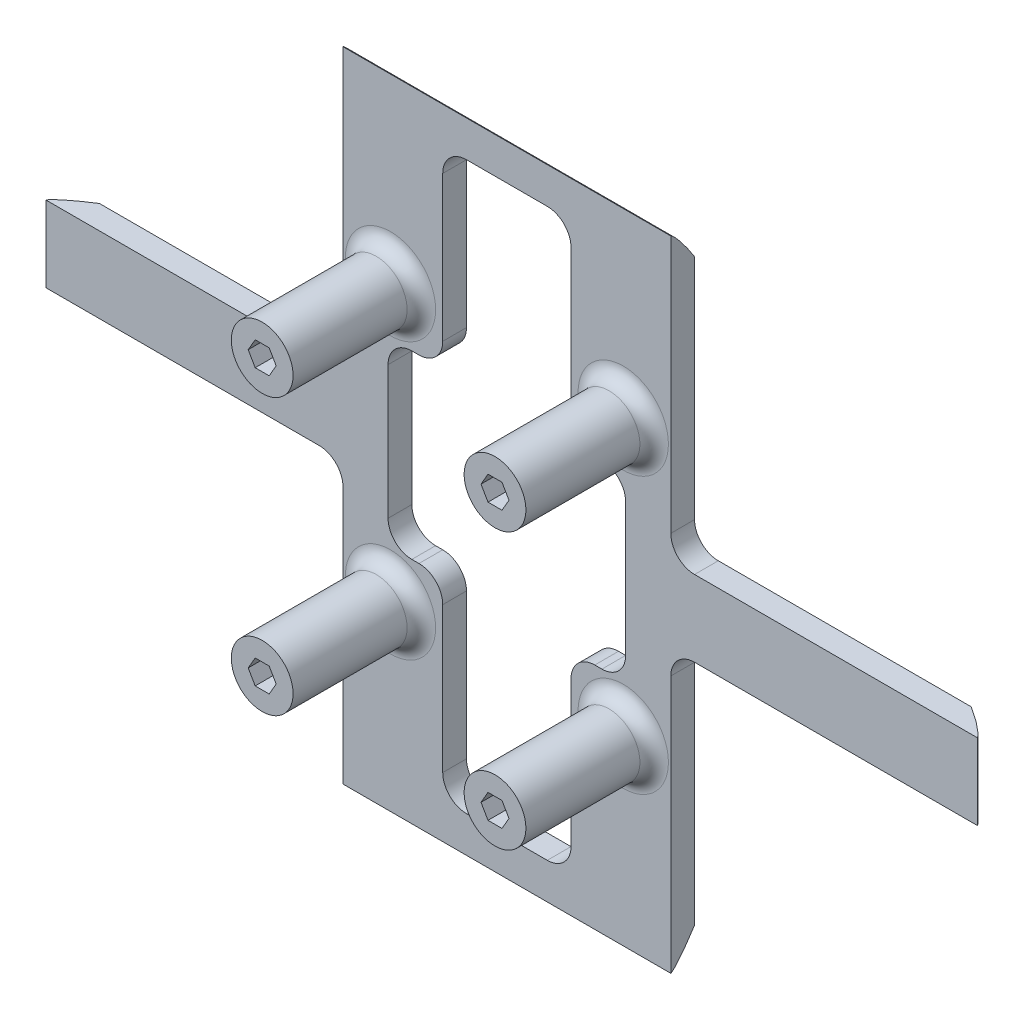
from build123d import *

# Parameters (mm, degrees)
BOSS_EXTRUDE1_DEPTH = 6.5
FILLET4_START       = -8
FILLET4_DEPTH       = 16
FILLET4_START_2     = -34.5
FILLET4_2_DEPTH     = 69
SKETCH4_W           = 251.095983112
SKETCH4_H           = 149.113377468
CUT_EXTRUDE2_DEPTH  = 1.5
SKETCH6_R           = 6.5
BOSS_EXTRUDE3_DEPTH = 27
FILLET3_R           = 3
CUT_EXTRUDE3_DEPTH  = 18
MIRROR1_START       = 6.5
MIRROR1_OUTLINE_R   = 6.5
MIRROR1_DEPTH       = 27
MIRROR1_2_DEPTH     = 9
CUT_EXTRUDE6_REACH  = 125.858


with BuildPart() as part:
    # Sketch1 → Boss-Extrude1 (new body)
    with BuildSketch(Plane.XY):
        with BuildLine():
            Line((34.5, -13), (34.5, -67.2))
            Line((34.5, -67.2), (-34.5, -67.2))
            Line((-34.5, -67.2), (-34.5, -13))
            ThreePointArc((-34.5, -13), (-35.964466094, -9.464466094), (-39.5, -8))
            Line((-39.5, -8), (-97, -8))
            Line((-97, -8), (-97, 8))
            Line((-97, 8), (-39.5, 8))
            ThreePointArc((-39.5, 8), (-35.964466094, 9.464466094), (-34.5, 13))
            Line((-34.5, 13), (-34.5, 67.2))
            Line((-34.5, 67.2), (34.5, 67.2))
            Line((34.5, 67.2), (34.5, 13))
            ThreePointArc((34.5, 13), (35.964466094, 9.464466094), (39.5, 8))
            Line((39.5, 8), (83.5, 8))
            Line((83.5, 8), (99, 8))
            Line((99, 8), (99, -8))
            Line((99, -8), (39.5, -8))
            ThreePointArc((39.5, -8), (35.964466094, -9.464466094), (34.5, -13))
        make_face()
    extrude(amount=BOSS_EXTRUDE1_DEPTH)

    # Fillet4: read off the stored shape, not the designer's step
    # Fillet4 outline → Fillet4 (cut)
    with BuildSketch(Plane(origin=(0, 0, 0), x_dir=(1, 0, 0), z_dir=(0, 1, 0)).offset(FILLET4_START)):
        with BuildLine():
            add(Edge.make_bspline(
                [(-97, -6.5), (-94.571389667, 0), (-87.632503002, 0)],
                knots=[0, 0, 0, 1, 1, 1], degree=2, weights=[1, 0.176470588, 1]))
            Line((-87.632503002, 0), (-97, 0))
            Line((-97, 0), (-97, -6.5))
        make_face()
        with BuildLine():
            add(Edge.make_bspline(
                [(99, -6.5), (96.571389667, 0), (89.632503002, 0)],
                knots=[0, 0, 0, 1, 1, 1], degree=2, weights=[1, 0.176470588, 1]))
            Line((99, -6.5), (99, 0))
            Line((99, 0), (89.632503002, 0))
        make_face()
    extrude(amount=FILLET4_DEPTH, mode=Mode.SUBTRACT)

    # Fillet4 2 outline → Fillet4 2 (cut)
    with BuildSketch(Plane.YZ.offset(FILLET4_START_2)):
        with BuildLine():
            Line((67.2, 0), (67.2, 6.5))
            add(Edge.make_bspline(
                [(67.2, 6.5), (64.771389667, 0), (57.832503002, 0)],
                knots=[0, 0, 0, 1, 1, 1], degree=2, weights=[1, 0.176470588, 1]))
            Line((57.832503002, 0), (67.2, 0))
        make_face()
        with BuildLine():
            Line((-67.2, 0), (-57.832503002, 0))
            add(Edge.make_bspline(
                [(-67.2, 6.5), (-64.771389667, 0), (-57.832503002, 0)],
                knots=[0, 0, 0, 1, 1, 1], degree=2, weights=[1, 0.176470588, 1]))
            Line((-67.2, 6.5), (-67.2, 0))
        make_face()
    extrude(amount=FILLET4_2_DEPTH, mode=Mode.SUBTRACT)

    # Sketch4 → Cut-Extrude2 (cut)
    with BuildSketch(Plane.XY):
        Rectangle(SKETCH4_W, SKETCH4_H)
    extrude(amount=CUT_EXTRUDE2_DEPTH, mode=Mode.SUBTRACT)

    # Sketch6 → Boss-Extrude3 (add)
    with BuildSketch(Plane.XY.offset(6.5)):
        with Locations((-24.5, 29)):
            Circle(SKETCH6_R)
    extrude(amount=BOSS_EXTRUDE3_DEPTH)

    # Fillet3
    fillet3_edges = [part.edges().sort_by_distance(p)[0] for p in [
        (-31, 29, 6.5),
    ]]
    fillet(fillet3_edges, radius=FILLET3_R)

    # Sketch7 → Cut-Extrude3 (cut)
    with BuildSketch(Plane.XY.offset(33.5)):
        Polygon((-27.444486373, 29), (-25.972243186, 26.45), (-23.027756814, 26.45), (-21.555513627, 29), (-23.027756814, 31.55), (-25.972243186, 31.55), align=None)
    extrude(amount=-CUT_EXTRUDE3_DEPTH, mode=Mode.SUBTRACT)

    # Mirror1: read off the stored shape, not the designer's step
    # Mirror1 outline → Mirror1 (add)
    # profile 1 of 3: a face of its own
    with BuildSketch(Plane.XY.offset(MIRROR1_START)):
        with Locations((24.5, 29)):
            Circle(MIRROR1_OUTLINE_R)
        Polygon((21.555513627, 29), (23.027756814, 31.55), (25.972243186, 31.55), (27.444486373, 29), (25.972243186, 26.45), (23.027756814, 26.45), align=None, mode=Mode.SUBTRACT)
    # profile 2 of 3: a face of its own
    with BuildSketch(Plane.XY.offset(MIRROR1_START)):
        with Locations((-24.5, -29)):
            Circle(MIRROR1_OUTLINE_R)
        Polygon((-23.027756814, -31.55), (-25.972243186, -31.55), (-27.444486373, -29), (-25.972243186, -26.45), (-23.027756814, -26.45), (-21.555513627, -29), align=None, mode=Mode.SUBTRACT)
    # profile 3 of 3: a face of its own
    with BuildSketch(Plane.XY.offset(MIRROR1_START)):
        with Locations((24.5, -29)):
            Circle(MIRROR1_OUTLINE_R)
        Polygon((23.027756814, -26.45), (25.972243186, -26.45), (27.444486373, -29), (25.972243186, -31.55), (23.027756814, -31.55), (21.555513627, -29), align=None, mode=Mode.SUBTRACT)
    extrude(amount=MIRROR1_DEPTH)

    # Mirror1 2 outline → Mirror1 2 (add)
    with BuildSketch(Plane.XY.offset(MIRROR1_START)):
        Polygon((25.972243186, 31.55), (23.027756814, 31.55), (21.555513627, 29), (23.027756814, 26.45), (25.972243186, 26.45), (27.444486373, 29), align=None)
        Polygon((-27.444486373, -29), (-25.972243186, -31.55), (-23.027756814, -31.55), (-21.555513627, -29), (-23.027756814, -26.45), (-25.972243186, -26.45), align=None)
        Polygon((27.444486373, -29), (25.972243186, -26.45), (23.027756814, -26.45), (21.555513627, -29), (23.027756814, -31.55), (25.972243186, -31.55), align=None)
    extrude(amount=MIRROR1_2_DEPTH)

    # Mirror1 3 outline → Mirror1 3 (revolve)
    with BuildSketch(Plane(origin=(24.5, 29, 0), x_dir=(1, 0, 0), z_dir=(0, -1, 0))):
        with BuildLine():
            ThreePointArc((9.5, 6.5), (7.378679656, 7.378679656), (6.5, 9.5))
            Line((6.5, 9.5), (6.5, 6.5))
            Line((6.5, 6.5), (9.5, 6.5))
        make_face()
    revolve(axis=Axis((24.5, 29, 0), (0, 0, 1)))

    # Mirror1 4 outline → Mirror1 4 (revolve)
    with BuildSketch(Plane(origin=(-24.5, -29, 0), x_dir=(1, 0, 0), z_dir=(0, -1, 0))):
        with BuildLine():
            ThreePointArc((9.5, 6.5), (7.378679656, 7.378679656), (6.5, 9.5))
            Line((6.5, 9.5), (6.5, 6.5))
            Line((6.5, 6.5), (9.5, 6.5))
        make_face()
    revolve(axis=Axis((-24.5, -29, 0), (0, 0, 1)))

    # Mirror1 5 outline → Mirror1 5 (revolve)
    with BuildSketch(Plane(origin=(24.5, -29, 0), x_dir=(1, 0, 0), z_dir=(0, -1, 0))):
        with BuildLine():
            ThreePointArc((9.5, 6.5), (7.378679656, 7.378679656), (6.5, 9.5))
            Line((6.5, 9.5), (6.5, 6.5))
            Line((6.5, 6.5), (9.5, 6.5))
        make_face()
    revolve(axis=Axis((24.5, -29, 0), (0, 0, 1)))

    # Sketch13 → Cut-Extrude6 (cut, up to next)
    with BuildSketch(Plane(origin=(0, 0, 1.5), x_dir=(-1, 0, 0), z_dir=(0, 0, -1)), mode=Mode.PRIVATE) as cut_extrude6_sk1:
        with BuildLine():
            Line((-13.5, 54.6), (-13.5, 24))
            ThreePointArc((-13.5, 24), (-14.964466094, 20.464466094), (-18.5, 19))
            Line((-18.5, 19), (-20, 19))
            ThreePointArc((-20, 19), (-23.535533906, 17.535533906), (-25, 14))
            Line((-25, 14), (-25, -14))
            ThreePointArc((-25, -14), (-23.535533906, -17.535533906), (-20, -19))
            Line((-20, -19), (-18.5, -19))
            ThreePointArc((-18.5, -19), (-14.964466094, -20.464466094), (-13.5, -24))
            Line((-13.5, -24), (-13.5, -54.6))
            ThreePointArc((-13.5, -54.6), (-12.035533906, -58.135533906), (-8.5, -59.6))
            Line((-8.5, -59.6), (8.5, -59.6))
            ThreePointArc((8.5, -59.6), (12.035533906, -58.135533906), (13.5, -54.6))
            Line((13.5, -54.6), (13.5, -24))
            ThreePointArc((13.5, -24), (14.964466094, -20.464466094), (18.5, -19))
            Line((18.5, -19), (20, -19))
            ThreePointArc((20, -19), (23.535533906, -17.535533906), (25, -14))
            Line((25, -14), (25, 14))
            ThreePointArc((25, 14), (23.535533906, 17.535533906), (20, 19))
            Line((20, 19), (18.5, 19))
            ThreePointArc((18.5, 19), (14.964466094, 20.464466094), (13.5, 24))
            Line((13.5, 24), (13.5, 54.6))
            ThreePointArc((13.5, 54.6), (12.035533906, 58.135533906), (8.5, 59.6))
            Line((8.5, 59.6), (-8.5, 59.6))
            ThreePointArc((-8.5, 59.6), (-12.035533906, 58.135533906), (-13.5, 54.6))
        make_face()
    cut_extrude6_tool1 = extrude(cut_extrude6_sk1.sketch, amount=-CUT_EXTRUDE6_REACH, mode=Mode.PRIVATE) & part.part
    add(cut_extrude6_tool1.solids().sort_by_distance((0, 0, 1.5))[0], mode=Mode.SUBTRACT)


solid = part.part
